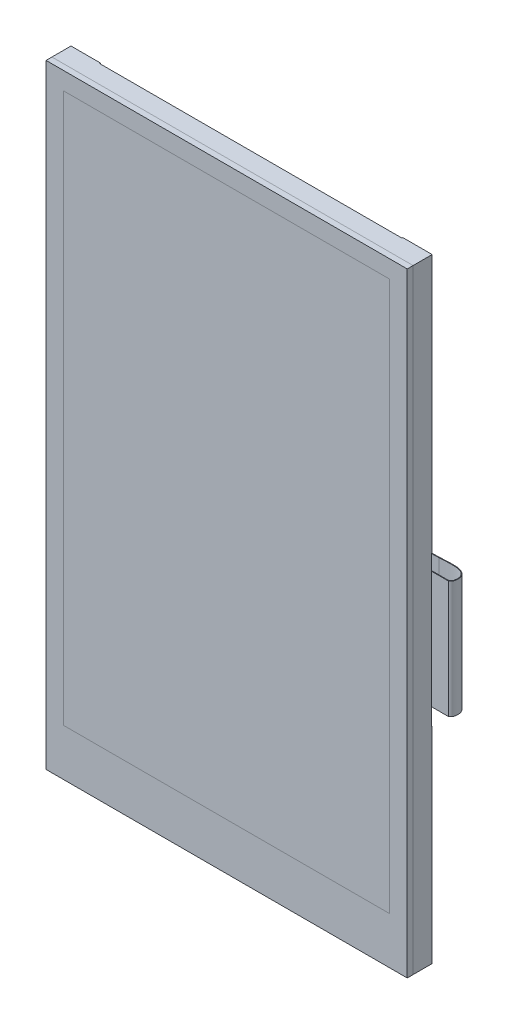
from build123d import *

# Parameters (mm, degrees)
SKETCH_1_W          = 61.55
SKETCH_1_H          = 104.65
EXTRUDE_1_DEPTH     = 4.1
EXTRUDE_2_DEPTH     = 0.1
SKETCH_13_W         = 5
SKETCH_13_H         = 89
SKETCH_13_H_2       = 44
SKETCH_13_H_3       = 35
EXTRUDE_3_DEPTH     = 0.15
SWEEP_START         = -14.325
SWEEP_1_DEPTH       = 20
SWEEP_START_2       = -6.005
SWEEP_2_DEPTH       = 12
CUT_EXTRUDE_1_REACH = 65.813
SKETCH_21_W         = 3.5
SKETCH_21_H         = 10
SKETCH_22_W         = 5
SKETCH_22_H         = 5
EXTRUDE_4_DEPTH     = 1
SKETCH_22_3_W       = 0.5
SKETCH_22_3_H       = 1
EXTRUDE_5_DEPTH     = 0.5


# Read off the part's stored shape, not the designer's step: 扫描1, 扫描2
with BuildPart() as part:
    # 草图1 → 凸台-拉伸1 (new body)
    with BuildSketch(Plane.XY):
        Rectangle(SKETCH_1_W, SKETCH_1_H)
    extrude(amount=EXTRUDE_1_DEPTH)

    # 草图12 → 凸台-拉伸2 (add)
    with BuildSketch(Plane(origin=(0, 0, 0), x_dir=(-1, 0, 0), z_dir=(0, 0, -1))):
        with BuildLine():
            Line((-30.775, 5.675), (7.43097714, 5.675))
            ThreePointArc((7.43097714, 5.675), (8.96553195, 5.039366586), (9.601165364, 3.504811776))
            Line((9.601165364, 3.504811776), (9.601165364, -37.354811776))
            ThreePointArc((9.601165364, -37.354811776), (10.236798778, -38.889366586), (11.771353588, -39.525))
            Line((11.771353588, -39.525), (25.622658883, -39.525))
            ThreePointArc((25.622658883, -39.525), (27.157213692, -40.160633414), (27.792847106, -41.695188224))
            Line((27.792847106, -41.695188224), (27.792847106, -52.325))
            Line((27.792847106, -52.325), (-18.797778056, -52.325))
            Line((-18.797778056, -52.325), (-18.797778056, -16.495188224))
            ThreePointArc((-18.797778056, -16.495188224), (-19.43341147, -14.960633414), (-20.96796628, -14.325))
            Line((-20.96796628, -14.325), (-30.775, -14.325))
            Line((-30.775, -14.325), (-30.775, 5.675))
        make_face()
    extrude(amount=EXTRUDE_2_DEPTH)

    # 草图13 → 凸台-拉伸3 (add)
    with BuildSketch(Plane(origin=(0, 0, 0), x_dir=(-1, 0, 0), z_dir=(0, 0, -1))):
        with Locations((28.275, 7.825)):
            Rectangle(SKETCH_13_W, SKETCH_13_H)
        with Locations((-28.275, 30.325)):
            Rectangle(SKETCH_13_W, SKETCH_13_H_2)
        with Locations((-28.275, -34.825)):
            Rectangle(SKETCH_13_W, SKETCH_13_H_3)
    extrude(amount=EXTRUDE_3_DEPTH)

    # 扫描1 outline → 扫描1 (add)
    with BuildSketch(Plane(origin=(0, 0, 0), x_dir=(1, 0, 0), z_dir=(0, 1, 0)).offset(SWEEP_START)):
        with BuildLine():
            Line((30.775, 0), (33.688057754, 0))
            add(Edge.make_bspline(
                [(33.688057754, 0), (33.740094349, 0.030384855), (33.842167666, 0.089986814), (33.957599344, 0.199336205), (34.055275833, 0.337544191), (34.127351146, 0.503103592), (34.185512523, 0.716829871), (34.22259154, 0.985198024), (34.217211516, 1.305147843), (34.157564693, 1.596323551), (34.059081534, 1.841158616), (33.942865451, 2.037727084), (33.787885639, 2.222839862), (33.590692863, 2.391010577), (33.262024043, 2.589254607), (32.734303663, 2.759632394), (32.006537514, 2.830109489), (31.159482774, 2.834077419), (30.301363299, 2.787487983), (29.724318905, 2.754110628), (29.465689882, 2.739151029)],
                knots=[0, 0, 0, 0, 0.022394077, 0.043927504, 0.06594757, 0.090294372, 0.118608139, 0.159927725, 0.205818656, 0.25470695, 0.285347598, 0.317202924, 0.350795774, 0.386909923, 0.42653968, 0.513682935, 0.622352859, 0.744271405, 0.885383452, 1, 1, 1, 1], degree=3))
            Line((29.465689882, 2.739151029), (16.573878781, 2.449987427))
            Line((16.573878781, 2.449987427), (16.576121219, 2.350012573))
            Line((16.576121219, 2.350012573), (29.468846669, 2.639196684))
            add(Edge.make_bspline(
                [(33.66280425, 0.1), (33.701165427, 0.12284106), (33.77641348, 0.167645351), (33.88316176, 0.26642733), (33.966512799, 0.385635161), (34.032372412, 0.535121016), (34.087077442, 0.736116999), (34.122405453, 0.991235451), (34.117202793, 1.294498152), (34.060993674, 1.568287463), (33.969014807, 1.796825073), (33.860895162, 1.979670143), (33.716718378, 2.151914558), (33.532385119, 2.309217599), (33.222301128, 2.496419386), (32.71697835, 2.660403065), (32.002919105, 2.730108386), (31.162255161, 2.734053994), (30.308880523, 2.687749647), (29.728825185, 2.654223135), (29.468846669, 2.639196684)],
                knots=[0, 0, 0, 0, 0.022394077, 0.043927504, 0.06594757, 0.090294372, 0.118608139, 0.159927725, 0.205818656, 0.25470695, 0.285347598, 0.317202924, 0.350795774, 0.386909923, 0.42653968, 0.513682935, 0.622352859, 0.744271405, 0.885383452, 1, 1, 1, 1], degree=3))
            Line((33.66280425, 0.1), (30.775, 0.1))
            Line((30.775, 0.1), (30.775, 0))
        make_face()
    extrude(amount=SWEEP_1_DEPTH)

    # 扫描2 outline → 扫描2 (add)
    with BuildSketch(Plane.YZ.offset(SWEEP_START_2)):
        with BuildLine():
            add(Edge.make_bspline(
                [(-52.325, 3), (-52.460602146, 2.893750812), (-52.722932906, 2.688205168), (-53.009596176, 2.286811717), (-53.236110287, 1.775702365), (-53.359405567, 1.129360272), (-53.359062945, 0.238903879), (-53.229025848, -0.783276027), (-52.933769169, -1.695551183), (-52.526896187, -2.296702581), (-52.132903591, -2.646463291), (-51.661381942, -2.902920315), (-50.942443081, -3.139445785), (-49.94695976, -3.245581242), (-48.75217865, -3.148841506), (-47.635336399, -2.915993871), (-46.974786487, -2.629681533), (-46.67140425, -2.498181891)],
                knots=[0, 0, 0, 0, 0.043360734, 0.083884028, 0.123581472, 0.184240498, 0.247655218, 0.345647149, 0.439787351, 0.484257058, 0.527954224, 0.57258299, 0.619125258, 0.717850297, 0.820060491, 0.917356055, 1, 1, 1, 1], degree=3))
            Line((-52.325, 3), (-52.325, 3.1))
            add(Edge.make_bspline(
                [(-52.325, 3.1), (-52.468608186, 2.993246309), (-52.746427128, 2.786724673), (-53.057421939, 2.375880968), (-53.306118632, 1.849117463), (-53.443742145, 1.185180174), (-53.453016098, 0.27667256), (-53.326868431, -0.756873175), (-53.036730374, -1.692169497), (-52.625569397, -2.326691599), (-52.219376389, -2.703311261), (-51.732982096, -2.977735995), (-50.993631594, -3.23110648), (-49.979600344, -3.345075131), (-48.766358256, -3.253086402), (-47.634912854, -3.022591855), (-46.957432057, -2.73424992), (-46.646273679, -2.601818109)],
                knots=[0, 0, 0, 0, 0.043360734, 0.083884028, 0.123581472, 0.184240498, 0.247655218, 0.345647149, 0.439787351, 0.484257058, 0.527954224, 0.57258299, 0.619125258, 0.717850297, 0.820060491, 0.917356055, 1, 1, 1, 1], degree=3))
            Line((-46.646273679, -2.601818109), (-28.485, -2.601818109))
            Line((-28.485, -2.601818109), (-28.485, -2.498181891))
            Line((-28.485, -2.498181891), (-46.67140425, -2.498181891))
        make_face()
    extrude(amount=SWEEP_2_DEPTH)

    # 草图21 → 切除-拉伸1 (cut, up to next)
    with BuildSketch(Plane(origin=(0, 0, -2.601818109), x_dir=(-1, 0, 0), z_dir=(0, 0, -1)), mode=Mode.PRIVATE) as cut_extrude_1_sk1:
        with Locations((-4.245, -33.485)):
            Rectangle(SKETCH_21_W, SKETCH_21_H)
    cut_extrude_1_tool1 = extrude(cut_extrude_1_sk1.sketch, amount=-CUT_EXTRUDE_1_REACH, mode=Mode.PRIVATE) & part.part
    # 草图21 → 切除-拉伸1 (cut, up to next)
    with BuildSketch(Plane(origin=(0, 0, -2.601818109), x_dir=(-1, 0, 0), z_dir=(0, 0, -1)), mode=Mode.PRIVATE) as cut_extrude_1_sk2:
        with Locations((4.255, -33.485)):
            Rectangle(SKETCH_21_W, SKETCH_21_H)
    cut_extrude_1_tool2 = extrude(cut_extrude_1_sk2.sketch, amount=-CUT_EXTRUDE_1_REACH, mode=Mode.PRIVATE) & part.part
    add(cut_extrude_1_tool1.solids().sort_by_distance((4.245, -33.485, -2.601818))[0], mode=Mode.SUBTRACT)
    add(cut_extrude_1_tool2.solids().sort_by_distance((-4.255, -33.485, -2.601818))[0], mode=Mode.SUBTRACT)

    # 草图22 → 凸台-拉伸4 (add)
    with BuildSketch(Plane(origin=(0, 0, -2.601818109), x_dir=(-1, 0, 0), z_dir=(0, 0, -1))):
        with Locations((0.005, -43.046273679)):
            Rectangle(SKETCH_22_W, SKETCH_22_H)
    extrude(amount=EXTRUDE_4_DEPTH)

    # 草图22<3> → 凸台-拉伸5 (add)
    with BuildSketch(Plane(origin=(0, 0, -2.601818109), x_dir=(-1, 0, 0), z_dir=(0, 0, -1))):
        with Locations((-3.445, -39.485)):
            Rectangle(SKETCH_22_3_W, SKETCH_22_3_H)
        with Locations((-2.445, -39.485)):
            Rectangle(SKETCH_22_3_W, SKETCH_22_3_H)
        with Locations((-1.445, -39.485)):
            Rectangle(SKETCH_22_3_W, SKETCH_22_3_H)
        with Locations((-0.445, -39.485)):
            Rectangle(SKETCH_22_3_W, SKETCH_22_3_H)
        with Locations((0.555, -39.485)):
            Rectangle(SKETCH_22_3_W, SKETCH_22_3_H)
        with Locations((1.555, -39.485)):
            Rectangle(SKETCH_22_3_W, SKETCH_22_3_H)
        with Locations((2.555, -39.485)):
            Rectangle(SKETCH_22_3_W, SKETCH_22_3_H)
        with Locations((3.555, -39.485)):
            Rectangle(SKETCH_22_3_W, SKETCH_22_3_H)
    extrude(amount=EXTRUDE_5_DEPTH)


solid = part.part
